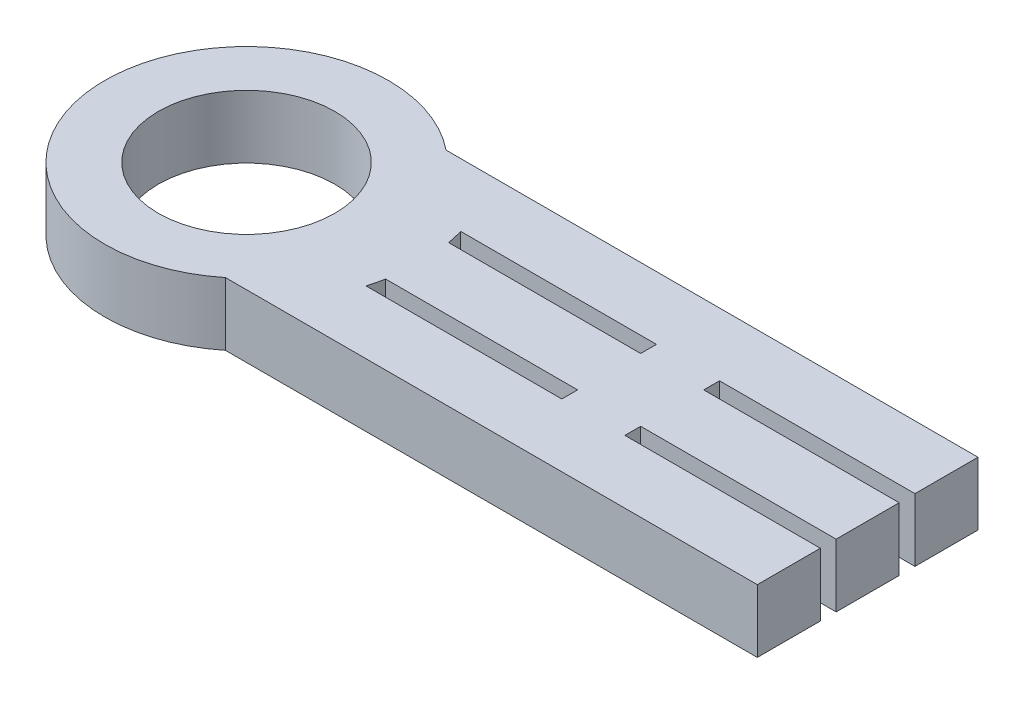
from build123d import *

# Parameters (mm, degrees)
STOCK_EXHAUST_M5_WASHER15_B_1_OUTLINE_R = 28
STOCK_EXHAUST_M5_WASHER15_B_1_DEPTH     = 20
SKETCH1_W                               = 20
SKETCH1_H                               = 20
CUT_EXTRUDE1_DEPTH                      = 3
LPATTERN1_COUNT                         = 2
LPATTERN1_PITCH                         = 25
LPATTERN1_COL_COUNT                     = 2
LPATTERN1_COL_PITCH                     = 25


# Read off the part's stored shape, not the designer's step: Stock-Exhaust_M5_washer15_B-1
with BuildPart() as part:
    # Stock-Exhaust_M5_washer15_B-1 outline → Stock-Exhaust_M5_washer15_B-1 (new body)
    with BuildSketch(Plane(origin=(0, 0, 0), x_dir=(1, 0, 0), z_dir=(0, 1, 0))):
        with BuildLine():
            Line((200, -15), (135, -15))
            Line((135, -15), (135, -10))
            Line((135, -10), (200, -10))
            Line((200, -10), (200, 10))
            Line((200, 10), (135, 10))
            Line((135, 10), (135, 15))
            Line((135, 15), (200, 15))
            Line((200, 15), (200, 35))
            Line((200, 35), (28.284271247, 35))
            ThreePointArc((28.284271247, 35), (-45, 0), (28.284271247, -35))
            Line((28.284271247, -35), (200, -35))
            Line((200, -35), (200, -15))
        make_face()
        with BuildLine():
            ThreePointArc((52.915026221, -15), (53.557527969, -12.513640473), (54.083269132, -10))
            Line((54.083269132, -10), (115, -10))
            Line((115, -10), (115, -15))
            Line((115, -15), (52.915026221, -15))
        make_face(mode=Mode.SUBTRACT)
        Circle(STOCK_EXHAUST_M5_WASHER15_B_1_OUTLINE_R, mode=Mode.SUBTRACT)
        with BuildLine():
            ThreePointArc((54.083269132, 10), (53.557527969, 12.513640473), (52.915026221, 15))
            Line((52.915026221, 15), (115, 15))
            Line((115, 15), (115, 10))
            Line((115, 10), (54.083269132, 10))
        make_face(mode=Mode.SUBTRACT)
    extrude(amount=STOCK_EXHAUST_M5_WASHER15_B_1_DEPTH)

    # Sketch1 → Cut-Extrude1 (cut)
    with BuildSketch(Plane(origin=(200, 0, 0), x_dir=(0, 0, -1), z_dir=(1, 0, 0))):
        with Locations((0, 10)):
            Rectangle(SKETCH1_W, SKETCH1_H)
    cut_extrude1 = extrude(amount=-CUT_EXTRUDE1_DEPTH, mode=Mode.SUBTRACT)

    # LPattern1: Cut-Extrude1 ×2
    with Locations(*[(0, 0, -i * LPATTERN1_PITCH) for i in range(1, LPATTERN1_COUNT)]):
        add(cut_extrude1, mode=Mode.SUBTRACT)

    # LPattern1 col: Cut-Extrude1 ×2
    with Locations(*[(0, 0, i * LPATTERN1_COL_PITCH) for i in range(1, LPATTERN1_COL_COUNT)]):
        add(cut_extrude1, mode=Mode.SUBTRACT)


solid = part.part
